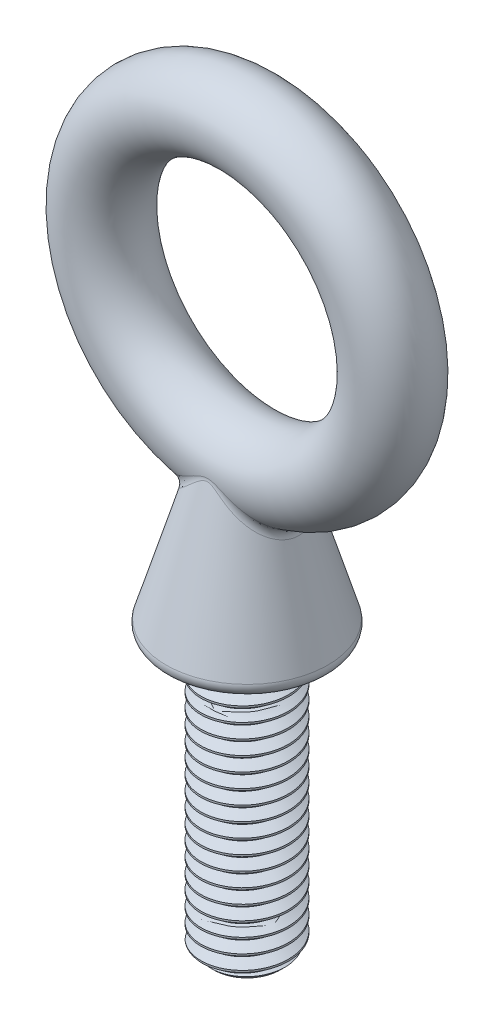
from build123d import *
from build123d.topology import SkipClean

# Parameters (mm, degrees)
BOSS_EXTRUDE1_START = -37.703125
SKETCH2_R           = 5.55625
BOSS_EXTRUDE1_DEPTH = 34.925
SKETCH5_OUTSIDE_W   = 94.368
SKETCH5_OUTSIDE_H   = 94.368
SKETCH5_OUTSIDE_R   = 4.181434671
CUT_EXTRUDE1_DEPTH  = 36.798037001
CUT_EXTRUDE1_DRAFT  = -45
SKETCH6_R           = 4.9609375
FILLET1_R           = 1.240234375
CUT_SWEEP1_PITCH    = 1.814285714
CUT_SWEEP1_TO       = 34.925
SKETCH9_R           = 5.55625
BOSS_EXTRUDE2_DEPTH = 2.54
BOSS_EXTRUDE2_TAPER = 45


with BuildPart() as part:
    # Sketch2 → Boss-Extrude1 (new body)
    with BuildSketch(Plane(origin=(0, 0, 0), x_dir=(1, 0, 0), z_dir=(0, 1, 0)).offset(BOSS_EXTRUDE1_START)):
        with Locations(Location((0, 0, 0), (0, 0, 270))):
            Circle(SKETCH2_R)
    extrude(amount=-BOSS_EXTRUDE1_DEPTH)


with BuildPart() as cut_extrude1_tool:
    # Sketch5 outside → Cut-Extrude1 (with draft: the straight prism first)
    with BuildSketch(Plane.XZ.offset(72.628125)):
        Rectangle(SKETCH5_OUTSIDE_W, SKETCH5_OUTSIDE_H)
        Circle(SKETCH5_OUTSIDE_R, mode=Mode.SUBTRACT)
    extrude(amount=-CUT_EXTRUDE1_DEPTH)
    # Cut-Extrude1: the draft: its side faces are tilted about the plane it starts from
    cut_extrude1_sides = [cut_extrude1_tool.faces().sort_by_distance(p)[0] for p in [
        (0, -54.229106499, -47.184),
        (47.184, -54.229106499, 0),
        (0, -54.229106499, 47.184),
        (-47.184, -54.229106499, 0),
        (-4.181434671, -54.229106499, 0),
    ]]
    draft(cut_extrude1_sides, Plane.XZ.offset(72.628125), CUT_EXTRUDE1_DRAFT)


with BuildPart() as part_1:
    add(part.part)

    # Cut-Extrude1: cut by cut_extrude1_tool
    add(cut_extrude1_tool.part, mode=Mode.SUBTRACT)



with BuildPart() as body_2:
    # Sketch6 → Revolve1 (revolve)
    with BuildSketch(Plane(origin=(0, 0, 0), x_dir=(0, 0, -1), z_dir=(1, 0, 0)), mode=Mode.PRIVATE) as revolve1_sk:
        with Locations((0, 18.4546875)):
            Circle(SKETCH6_R)
    revolve(revolve1_sk.sketch.rotate(Axis((0, 0, -7.63984375), (0, 0, 1)), 90), axis=Axis((0, 0, -7.63984375), (0, 0, 1)))


with BuildPart() as part_2:
    with SkipClean():  # the faces are left unmerged after this step: merging them gives an invalid solid
        add(part_1.part)

        add(body_2.part)  # Revolve2 merges body 2
        # Sketch8 → Revolve2 (revolve)
        with BuildSketch(Plane.XY, mode=Mode.PRIVATE) as revolve2_sk:
            with BuildLine():
                Line((0, -37.703125), (0, -18.4546875))
                Line((0, -18.4546875), (-4.9609375, -18.4546875))
                Line((-4.9609375, -18.4546875), (-10.266260095, -36.105897098))
                ThreePointArc((-10.266260095, -36.105897098), (-10.073738452, -37.202966858), (-9.078515625, -37.703125))
                Line((-9.078515625, -37.703125), (0, -37.703125))
            make_face()
        revolve(revolve2_sk.sketch.rotate(Axis((0, -37.703125, 0), (0, 1, 0)), 270), axis=Axis((0, -37.703125, 0), (0, 1, 0)))

    # Fillet1
    fillet1_edges = [part_2.edges().sort_by_distance(p)[0] for p in [
        (6.200763312, -22.579681762, 9.529e-06),
    ]]
    fillet(fillet1_edges, radius=FILLET1_R)


with BuildPart() as body_2_2:
    # Split1: the piece on the far side of the plane
    add(part_2.part)
    split(bisect_by=Plane(origin=(0, -37.703125, 0), x_dir=(-1, 0, 0), z_dir=(0, -1, 0)), keep=Keep.BOTTOM)


with BuildPart() as part_3:
    add(part_2.part)

    # Split1
    split(bisect_by=Plane(origin=(0, -37.703125, 0), x_dir=(-1, 0, 0), z_dir=(0, -1, 0)), keep=Keep.TOP)

    # Cut-Sweep1: arcs per turn and ends read off the stored shape
    # Cut-Sweep1: the profile of Sketch4 screwed along a right-hand helix through 20.25 turns, 10 arcs to a turn; built about Z, then put on its axis
    cut_sweep1_z = Axis((0, 0, 0), (0, 0, 1))
    cut_sweep1_corners = [(4.377836861, 0, -0.680357143), (4.377836861, 0, -0.907142857), (5.654451095, 0, -1.644196429), (5.654451095, 0, 0.056696429)]
    with BuildLine(mode=Mode.PRIVATE) as cut_sweep1_profile:
        Line(cut_sweep1_corners[0], cut_sweep1_corners[1])
        Line(cut_sweep1_corners[1], cut_sweep1_corners[2])
        Line(cut_sweep1_corners[2], cut_sweep1_corners[3])
        Line(cut_sweep1_corners[3], cut_sweep1_corners[0])
    cut_sweep1_cap = Face(cut_sweep1_profile.wire())
    cut_sweep1_turn_angles = [0, 18, 36, 54, 72, 90, 108, 126, 144, 162, 180, 198, 216, 234, 252, 270, 288, 306, 324, 342, 360]
    cut_sweep1_turn_weights = [1, 0.9510565162951535, 1, 0.9510565162951535, 1, 0.9510565162951535, 1, 0.9510565162951535, 1, 0.9510565162951535, 1, 0.9510565162951535, 1, 0.9510565162951535, 1, 0.9510565162951535, 1, 0.9510565162951535, 1, 0.9510565162951535, 1]
    cut_sweep1_turn_rails = [Edge.make_bspline([Vector(p[0], p[1], 0).rotate(cut_sweep1_z, cut_sweep1_turn_angles[k]) / cut_sweep1_turn_weights[k] + Vector(0, 0, p[2] + CUT_SWEEP1_PITCH * cut_sweep1_turn_angles[k] / 360) for k in range(21)], [0, 0, 0, 1, 1, 2, 2, 3, 3, 4, 4, 5, 5, 6, 6, 7, 7, 8, 8, 9, 9, 10, 10, 10], 2, cut_sweep1_turn_weights) for p in cut_sweep1_corners]
    cut_sweep1_turn_sides = [Face.make_surface_from_curves(cut_sweep1_turn_rails[p[0]], cut_sweep1_turn_rails[p[1]]) for p in [(0, 1), (1, 2), (2, 3), (3, 0)]]
    cut_sweep1_last_angles = [7200, 7218, 7236, 7254, 7272, 7281, 7290]
    cut_sweep1_last_weights = [1, 0.9510565162951535, 1, 0.9510565162951535, 1, 0.9876883405952495, 1]
    cut_sweep1_last_rails = [Edge.make_bspline([Vector(p[0], p[1], 0).rotate(cut_sweep1_z, cut_sweep1_last_angles[k]) / cut_sweep1_last_weights[k] + Vector(0, 0, p[2] + CUT_SWEEP1_PITCH * cut_sweep1_last_angles[k] / 360) for k in range(7)], [0, 0, 0, 1, 1, 2, 2, 3, 3, 3], 2, cut_sweep1_last_weights) for p in cut_sweep1_corners]
    cut_sweep1_last_sides = [Face.make_surface_from_curves(cut_sweep1_last_rails[p[0]], cut_sweep1_last_rails[p[1]]) for p in [(0, 1), (1, 2), (2, 3), (3, 0)]]
    cut_sweep1 = Plane(origin=(0, -72.628125, 0), x_dir=(1, 0, 0), z_dir=(0, 1, 0)) * split(Solid(Shell([*[p.moved(Location((0, 0, CUT_SWEEP1_PITCH * i))) for i in range(20) for p in cut_sweep1_turn_sides], *cut_sweep1_last_sides, cut_sweep1_cap, cut_sweep1_cap.rotate(cut_sweep1_z, 7290).moved(Location((0, 0, CUT_SWEEP1_PITCH * 7290 / 360)))])), bisect_by=Plane.XY.offset(CUT_SWEEP1_TO), keep=Keep.BOTTOM, mode=Mode.PRIVATE)
    add(cut_sweep1, mode=Mode.SUBTRACT)

    add(body_2_2.part)  # Boss-Extrude2 merges body 2 2
    # Sketch9 → Boss-Extrude2 (add)
    with BuildSketch(Plane.XZ.offset(37.703125)):
        Circle(SKETCH9_R)
    extrude(amount=BOSS_EXTRUDE2_DEPTH, taper=BOSS_EXTRUDE2_TAPER)


solid = part_3.part
